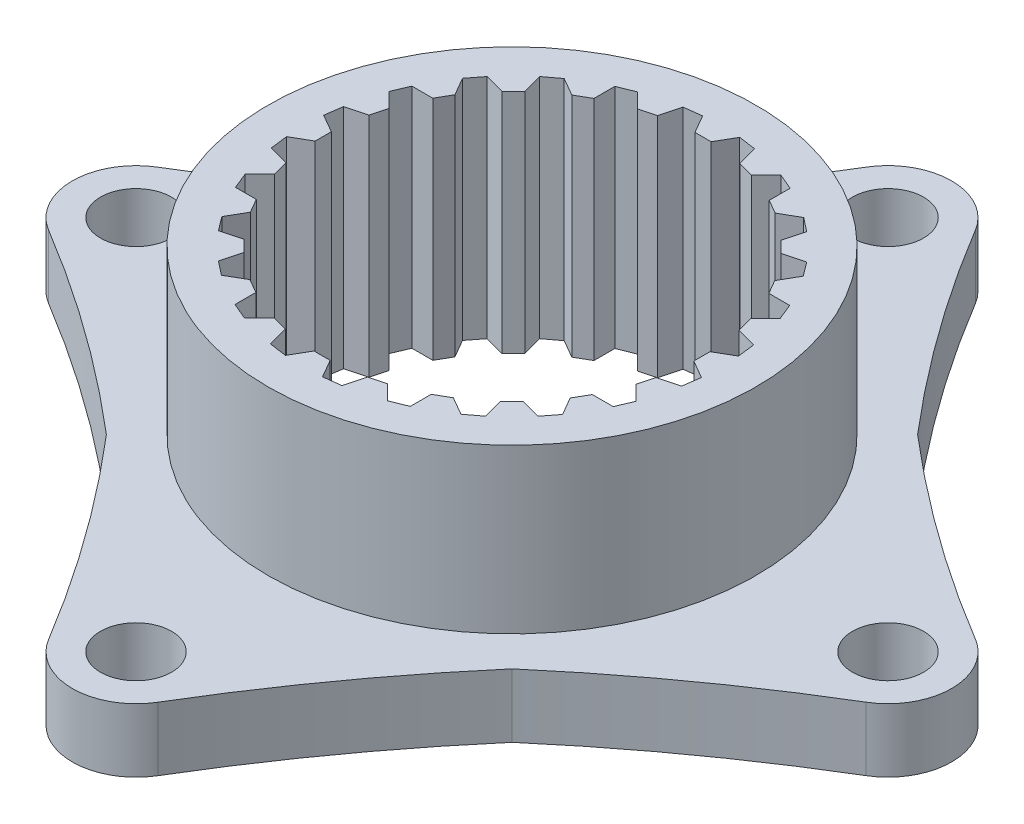
from build123d import *

# Parameters (mm, degrees)
SKETCH8_R           = 100
BOSS_EXTRUDE4_DEPTH = 27.178
CUT_EXTRUDE1_DEPTH  = 145.009179166
SKETCH9_OUTSIDE_W   = 258.83
SKETCH9_OUTSIDE_H   = 258.83
SKETCH9_OUTSIDE_RX  = 29.21
SKETCH9_OUTSIDE_RY  = 29.21
CUT_EXTRUDE3_DEPTH  = 19.558
SKETCH10_RX         = 4.2545
SKETCH10_RY         = 4.2545
CUT_EXTRUDE4_DEPTH  = 7.62
CUT_EXTRUDE5_START  = -7.62
SKETCH11_R          = 100
CUT_EXTRUDE5_DEPTH  = 7.62


with BuildPart() as part:
    # Sketch8 → Boss-Extrude4 (new body)
    with BuildSketch(Plane(origin=(0, 0, 0), x_dir=(1, 0, 0), z_dir=(0, 1, 0))):
        Circle(SKETCH8_R)
    extrude(amount=BOSS_EXTRUDE4_DEPTH)

    # Sketch6 → Cut-Extrude1 (cut, through all)
    with BuildSketch(Plane(origin=(0, 0, 0), x_dir=(1, 0, 0), z_dir=(0, 1, 0))):
        Polygon((-0.9689411, -22.736267788), (0.9689411, -22.736267788), (2.2189411, -24.901331298), (4.303288018, -24.645405677), (4.950335631, -22.230591111), (6.822186096, -21.72903029), (8.589953049, -23.496797243), (10.537039143, -22.710123397), (10.537039143, -20.210123397), (12.215294358, -19.241182297), (14.380357867, -20.491182297), (16.057492438, -19.227370749), (15.410444825, -16.812556183), (16.78073447, -15.442266539), (19.195549035, -16.089314151), (20.488438134, -14.434491569), (19.238438134, -12.269428059), (20.207379233, -10.591172845), (22.707379233, -10.591172845), (23.527914603, -8.658112653), (21.76014765, -6.8903457), (22.261708471, -5.018495235), (24.676523036, -4.371447622), (24.968786548, -2.291884678), (22.803723039, -1.041884678), (22.803723039, 0.895997521), (24.968786548, 2.145997521), (24.712860927, 4.23034444), (22.298046362, 4.877392053), (21.796485541, 6.749242517), (23.564252494, 8.51700947), (22.777578648, 10.464095565), (20.277578648, 10.464095565), (19.308637548, 12.142350779), (20.558637548, 14.307414289), (19.294826, 15.98454886), (16.880011434, 15.337501247), (15.509721789, 16.707790891), (16.156769402, 19.122605457), (14.50194682, 20.415494555), (12.33688331, 19.165494555), (10.658628096, 20.134435655), (10.658628096, 22.634435655), (8.725567904, 23.454971025), (6.957800951, 21.687204072), (5.085950486, 22.188764892), (4.438902873, 24.603579458), (2.359339929, 24.89584297), (1.109339929, 22.730779461), (-0.828542271, 22.730779461), (-2.078542271, 24.89584297), (-4.162889189, 24.639917349), (-4.809936802, 22.225102783), (-6.681787267, 21.723541963), (-8.44955422, 23.491308916), (-10.396640314, 22.70463507), (-10.396640314, 20.20463507), (-12.074895529, 19.23569397), (-14.239959038, 20.48569397), (-15.917093609, 19.221882421), (-15.270045996, 16.807067856), (-16.640335641, 15.436778211), (-19.055150206, 16.083825824), (-20.348039305, 14.429003241), (-19.098039305, 12.263939732), (-20.066980404, 10.585684518), (-22.566980404, 10.585684518), (-23.387515774, 8.652624325), (-21.619748821, 6.884857372), (-22.121309642, 5.013006908), (-24.536124207, 4.365959295), (-24.828387719, 2.28639635), (-22.66332421, 1.03639635), (-22.66332421, -0.901485849), (-24.828387719, -2.151485849), (-24.572462098, -4.235832767), (-22.157647532, -4.88288038), (-21.656086712, -6.754730845), (-23.423853665, -8.522497798), (-22.637179819, -10.469583893), (-20.137179819, -10.469583893), (-19.168238719, -12.147839107), (-20.418238719, -14.312902616), (-19.154427171, -15.990037187), (-16.739612605, -15.342989575), (-15.36932296, -16.713279219), (-16.016370573, -19.128093785), (-14.361547991, -20.420982883), (-12.196484481, -19.170982883), (-10.518229267, -20.139923983), (-10.518229267, -22.639923983), (-8.585169075, -23.460459352), (-6.817402122, -21.6926924), (-4.945551657, -22.19425322), (-4.298504044, -24.609067786), (-2.2189411, -24.901331298), align=None)
    extrude(amount=CUT_EXTRUDE1_DEPTH, mode=Mode.SUBTRACT)

    # Sketch9 outside → Cut-Extrude3 (cut)
    with BuildSketch(Plane(origin=(0, 27.178, 0), x_dir=(1, 0, 0), z_dir=(0, 1, 0))):
        Rectangle(SKETCH9_OUTSIDE_W, SKETCH9_OUTSIDE_H)
        with Locations(Location((0, 0), (0, 0, -110.60898234))):
            Ellipse(SKETCH9_OUTSIDE_RX, SKETCH9_OUTSIDE_RY, mode=Mode.SUBTRACT)
    extrude(amount=-CUT_EXTRUDE3_DEPTH, mode=Mode.SUBTRACT)

    # Sketch10 → Cut-Extrude4 (cut)
    with BuildSketch(Plane(origin=(0, 7.62, 0), x_dir=(1, 0, 0), z_dir=(0, 1, 0))):
        with Locations(Location((45.0088, 0), (0, 0, 0))):
            Ellipse(SKETCH10_RX, SKETCH10_RY)
        with Locations(Location((0, 45.0088), (0, 0, 90))):
            Ellipse(SKETCH10_RX, SKETCH10_RY)
        with Locations(Location((-45.0088, 0), (0, 0, -180))):
            Ellipse(SKETCH10_RX, SKETCH10_RY)
        with Locations(Location((0, -45.0088), (0, 0, -90))):
            Ellipse(SKETCH10_RX, SKETCH10_RY)
    extrude(amount=-CUT_EXTRUDE4_DEPTH, mode=Mode.SUBTRACT)

    # Sketch11 → Cut-Extrude5 (cut)
    with BuildSketch(Plane(origin=(0, 7.62, 0), x_dir=(1, 0, 0), z_dir=(0, 1, 0)).offset(CUT_EXTRUDE5_START)):
        Circle(SKETCH11_R)
        with BuildLine():
            ThreePointArc((24.277161291, -24.273876949), (14.891613452, -36.228538142), (6.53888578, -48.926347911))
            add(Edge.make_bspline(
                [(-6.532266259, -48.927232138), (0.004047247, -59.828745782), (6.53888578, -48.926347911)],
                knots=[2.110905864, 2.110905864, 2.110905864, 4.172414738, 4.172414738, 4.172414738], degree=2, weights=[1, 0.51417192, 1]))
            ThreePointArc((-6.532266259, -48.927232138), (-14.886711797, -36.230552563), (-24.273876949, -24.277161291))
            ThreePointArc((-24.273876949, -24.277161291), (-36.228538142, -14.891613452), (-48.926347911, -6.53888578))
            add(Edge.make_bspline(
                [(-48.927232138, 6.532266259), (-59.828745782, -0.004047247), (-48.926347911, -6.53888578)],
                knots=[2.110905864, 2.110905864, 2.110905864, 4.172414738, 4.172414738, 4.172414738], degree=2, weights=[1, 0.51417192, 1]))
            ThreePointArc((-48.927232138, 6.532266259), (-36.230552563, 14.886711797), (-24.277161291, 24.273876949))
            ThreePointArc((-24.277161291, 24.273876949), (-14.891613452, 36.228538142), (-6.53888578, 48.926347911))
            add(Edge.make_bspline(
                [(6.532266259, 48.927232138), (-0.004047247, 59.828745782), (-6.53888578, 48.926347911)],
                knots=[2.110905864, 2.110905864, 2.110905864, 4.172414738, 4.172414738, 4.172414738], degree=2, weights=[1, 0.51417192, 1]))
            ThreePointArc((6.532266259, 48.927232138), (14.886711797, 36.230552563), (24.273876949, 24.277161291))
            ThreePointArc((24.273876949, 24.277161291), (36.228538142, 14.891613452), (48.926347911, 6.53888578))
            add(Edge.make_bspline(
                [(48.927232138, -6.532266259), (59.828745782, 0.004047247), (48.926347911, 6.53888578)],
                knots=[3.681702191, 3.681702191, 3.681702191, 5.743211065, 5.743211065, 5.743211065], degree=2, weights=[1, 0.51417192, 1]))
            ThreePointArc((48.927232138, -6.532266259), (36.230552563, -14.886711797), (24.277161291, -24.273876949))
        make_face(mode=Mode.SUBTRACT)
    extrude(amount=CUT_EXTRUDE5_DEPTH, mode=Mode.SUBTRACT)


solid = part.part
